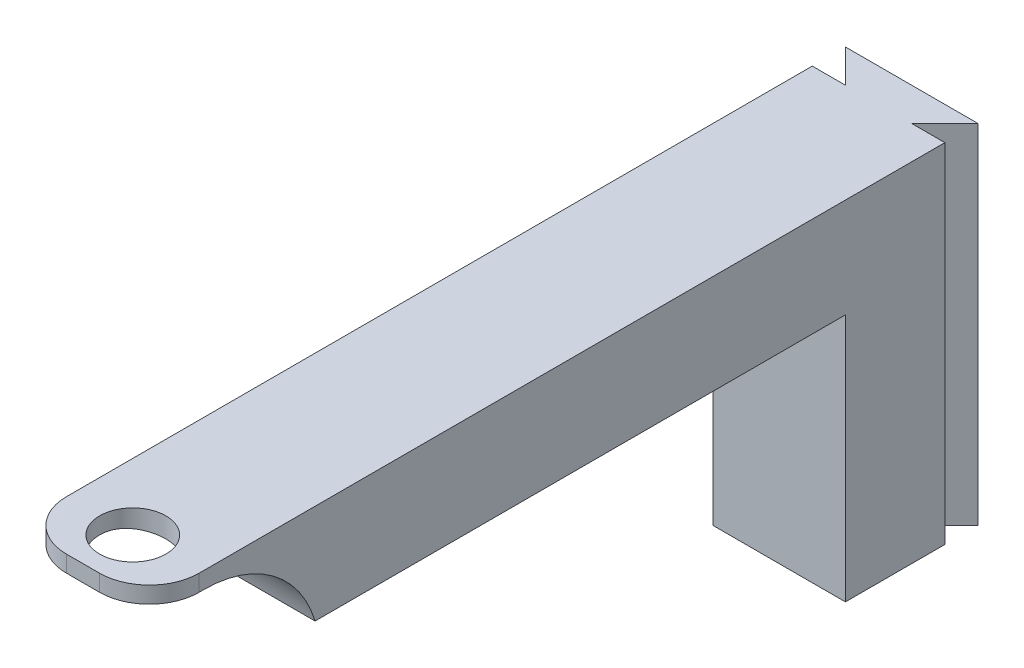
from build123d import *

# Parameters (mm, degrees)
SKETCH1_W                      = 8
SKETCH1_H                      = 50
BOSS_EXTRUDE1_DEPTH            = 6
SKETCH2_W                      = 8
SKETCH2_H                      = 10
CUT_EXTRUDE2_DEPTH             = 5
CUT_EXTRUDE3_REACH             = 28.019
SKETCH3_R                      = 2
FILLET1_R                      = 3
FILLET2_R                      = 7
SKETCH4_W                      = 8
SKETCH4_H                      = 8
BOSS_EXTRUDE2_DEPTH            = 15
CUT_EXTRUDE4_REACH             = 34.894
CUT_EXTRUDE4_DIRECTION_2_DEPTH = 33.893768419


with BuildPart() as part:
    # Sketch1 → Boss-Extrude1 (new body)
    with BuildSketch(Plane(origin=(0, 0, 0), x_dir=(1, 0, 0), z_dir=(0, 1, 0))):
        Rectangle(SKETCH1_W, SKETCH1_H)
    extrude(amount=BOSS_EXTRUDE1_DEPTH)

    # Sketch2 → Cut-Extrude2 (cut)
    with BuildSketch(Plane.XZ):
        with Locations((0, 20)):
            Rectangle(SKETCH2_W, SKETCH2_H)
    extrude(amount=-CUT_EXTRUDE2_DEPTH, mode=Mode.SUBTRACT)

    # Sketch3 → Cut-Extrude3 (cut, up to next)
    with BuildSketch(Plane(origin=(0, 6, 0), x_dir=(1, 0, 0), z_dir=(0, 1, 0)), mode=Mode.PRIVATE) as cut_extrude3_sk1:
        with Locations(Location((0, -22, 0), (0, 0, 270))):
            Circle(SKETCH3_R)
    cut_extrude3_tool1 = extrude(cut_extrude3_sk1.sketch, amount=-CUT_EXTRUDE3_REACH, mode=Mode.PRIVATE) & part.part
    add(cut_extrude3_tool1.solids().sort_by_distance((0, 6, 22))[0], mode=Mode.SUBTRACT)

    # Fillet1
    fillet1_edges = [part.edges().sort_by_distance(p)[0] for p in [
        (4, 5.5, 25),
        (-4, 5.5, 25),
    ]]
    fillet(fillet1_edges, radius=FILLET1_R)

    # Fillet2
    # the kernel refuses this fillet: 7 mm, written as the material it adds along each edge
    with BuildSketch(Plane(origin=(-4, 5, 15), x_dir=(0, 0, 1), z_dir=(1, 0, 0))) as fillet2_piece_1_section:
        with BuildLine():
            CenterArc((6.708203932, 7), FILLET2_R, 196.601549599, 73.398450401)
            Line((0, 5), (0, 0))
            Line((0, 0), (6.708203932, 0))
        make_face()
    fillet2_piece_1 = extrude(amount=8, mode=Mode.PRIVATE)
    fillet2_piece_1 = fillet2_piece_1 - Plane(origin=(0, 5, 22), x_dir=(0, 0, 1), z_dir=(0, 1, 0)) * Cylinder(2, 43, mode=Mode.PRIVATE)
    add(fillet2_piece_1)

    # Sketch4 → Boss-Extrude2 (add)
    with BuildSketch(Plane(origin=(0, 0, 0), x_dir=(-1, 0, 0), z_dir=(0, -1, 0))):
        with Locations((0, 21)):
            Rectangle(SKETCH4_W, SKETCH4_H)
    extrude(amount=BOSS_EXTRUDE2_DEPTH)

    # Sketch5 → Cut-Extrude4 (cut, up to next)
    with BuildSketch(Plane(origin=(0, 6, 0), x_dir=(1, 0, 0), z_dir=(0, 1, 0)), mode=Mode.PRIVATE) as cut_extrude4_sk1:
        Polygon((4, 25), (4, 23), (2, 23), align=None)
    cut_extrude4_tool1 = extrude(cut_extrude4_sk1.sketch, amount=-CUT_EXTRUDE4_REACH, mode=Mode.PRIVATE) & part.part
    # Sketch5 → Cut-Extrude4 (cut, up to next)
    with BuildSketch(Plane(origin=(0, 6, 0), x_dir=(1, 0, 0), z_dir=(0, 1, 0)), mode=Mode.PRIVATE) as cut_extrude4_sk2:
        Polygon((-4, 25), (-4, 23), (-2, 23), align=None)
    cut_extrude4_tool2 = extrude(cut_extrude4_sk2.sketch, amount=-CUT_EXTRUDE4_REACH, mode=Mode.PRIVATE) & part.part
    add(cut_extrude4_tool1.solids().sort_by_distance((3.333333, 6, -23.666667))[0], mode=Mode.SUBTRACT)
    add(cut_extrude4_tool2.solids().sort_by_distance((-3.333333, 6, -23.666667))[0], mode=Mode.SUBTRACT)

    # Sketch5 → Cut-Extrude4 direction 2 (cut)
    with BuildSketch(Plane(origin=(0, 6, 0), x_dir=(1, 0, 0), z_dir=(0, 1, 0))):
        Polygon((4, 25), (4, 23), (2, 23), align=None)
        Polygon((-4, 25), (-4, 23), (-2, 23), align=None)
    extrude(amount=CUT_EXTRUDE4_DIRECTION_2_DEPTH, mode=Mode.SUBTRACT)


solid = part.part
